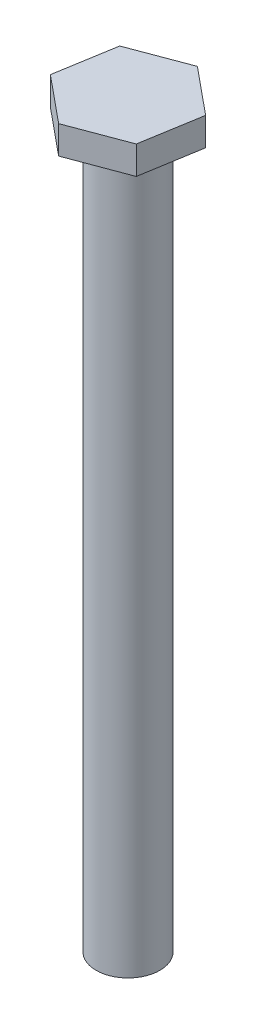
from build123d import *

# Parameters (mm, degrees)
SKETCH1_R   = 7.9375
SHAFT_DEPTH = 177.8
HEAD_DEPTH  = 7


with BuildPart() as part:
    # Sketch1 → Shaft (new body)
    with BuildSketch(Plane(origin=(0, 0, 0), x_dir=(1, 0, 0), z_dir=(0, 1, 0))):
        Circle(SKETCH1_R)
    extrude(amount=-SHAFT_DEPTH)

    # Sketch2 → Head (add)
    with BuildSketch(Plane(origin=(0, 0, 0), x_dir=(1, 0, 0), z_dir=(0, 1, 0))):
        Polygon((11.595031913, -9.533549616), (14.053812112, 5.274817386), (2.458780199, 14.808367002), (-11.595031913, 9.533549616), (-14.053812112, -5.274817386), (-2.458780199, -14.808367002), align=None)
    extrude(amount=HEAD_DEPTH)


solid = part.part
